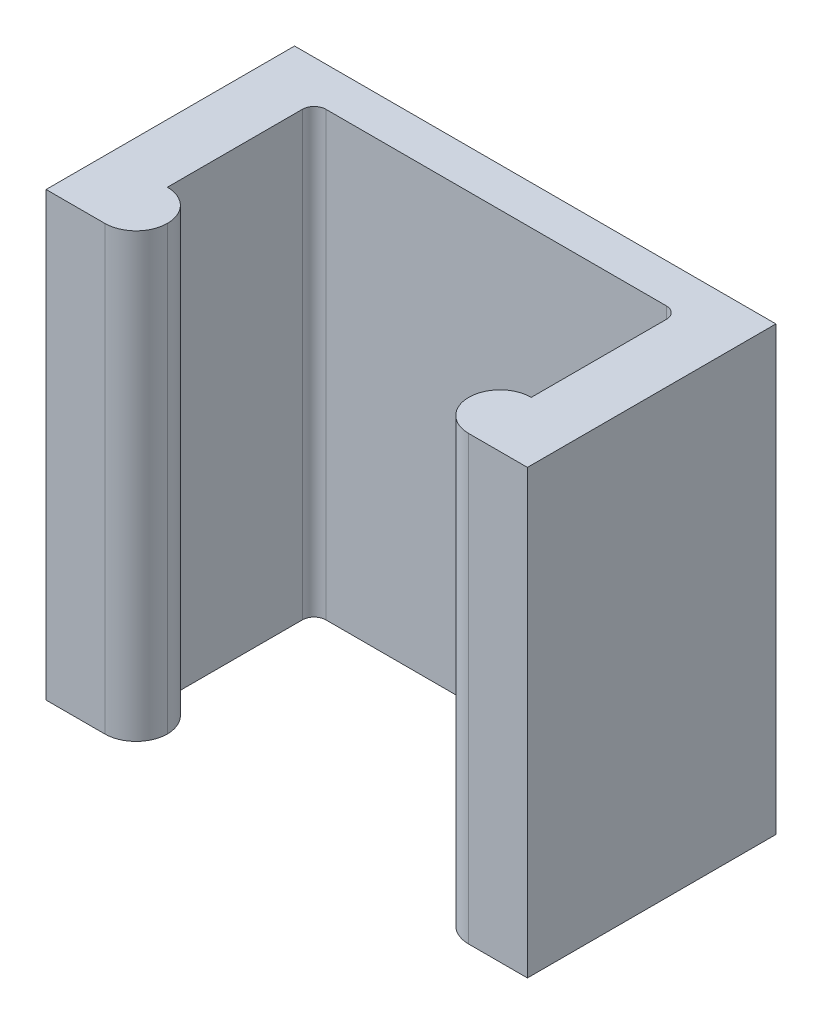
from build123d import *

# Parameters (mm, degrees)
SKETCH_1_W          = 12.3
SKETCH_1_H          = 11.3
EXTRUDE_1_DEPTH     = 2
SKETCH_2_W          = 1.5
SKETCH_2_H          = 11.3
EXTRUDE_2_DEPTH     = 4.35
SKETCH_5_W          = 9.3
SKETCH_5_H          = 11.5
CUT_EXTRUDE_1_DEPTH = 1
SKETCH_8_W          = 1.6
SKETCH_8_H          = 11.3
EXTRUDE_5_DEPTH     = 0.8
SKETCH_9_W          = 1.6
SKETCH_9_H          = 11.3
EXTRUDE_6_DEPTH     = 0.8
FILLET_7_R          = 0.8
FILLET_8_R          = 0.3


with BuildPart() as part:
    # 스케치1 → 보스-돌출1 (new body)
    with BuildSketch(Plane.XY):
        Rectangle(SKETCH_1_W, SKETCH_1_H)
    extrude(amount=EXTRUDE_1_DEPTH)

    # 스케치2 → 보스-돌출2 (add)
    with BuildSketch(Plane.XY.offset(2)):
        with Locations((-5.4, 0)):
            Rectangle(SKETCH_2_W, SKETCH_2_H)
        with Locations((5.4, 0)):
            Rectangle(SKETCH_2_W, SKETCH_2_H)
    extrude(amount=EXTRUDE_2_DEPTH)

    # 스케치5 → 컷-돌출1 (cut)
    with BuildSketch(Plane.XY.offset(2)):
        Rectangle(SKETCH_5_W, SKETCH_5_H)
    extrude(amount=-CUT_EXTRUDE_1_DEPTH, mode=Mode.SUBTRACT)

    # 스케치8 → 보스-돌출5 (add)
    with BuildSketch(Plane(origin=(-4.65, 0, 0), x_dir=(0, 0, -1), z_dir=(1, 0, 0))):
        with Locations((-5.55, 0)):
            Rectangle(SKETCH_8_W, SKETCH_8_H)
    extrude(amount=EXTRUDE_5_DEPTH)

    # 스케치9 → 보스-돌출6 (add)
    with BuildSketch(Plane.ZY.offset(-4.65)):
        with Locations((5.55, 0)):
            Rectangle(SKETCH_9_W, SKETCH_9_H)
    extrude(amount=EXTRUDE_6_DEPTH)

    # 필렛7
    fillet_7_edges = [part.edges().sort_by_distance(p)[0] for p in [
        (3.85, 0, 6.35),
        (-3.85, 0, 6.35),
        (3.85, 0, 4.75),
        (-3.85, 0, 4.75),
    ]]
    fillet(fillet_7_edges, radius=FILLET_7_R - 0.0001)  # a hair under: the kernel refuses the full size

    # 필렛8
    fillet_8_edges = [part.edges().sort_by_distance(p)[0] for p in [
        (4.65, 0, 1),
        (-4.65, 0, 1),
    ]]
    fillet(fillet_8_edges, radius=FILLET_8_R)


solid = part.part
